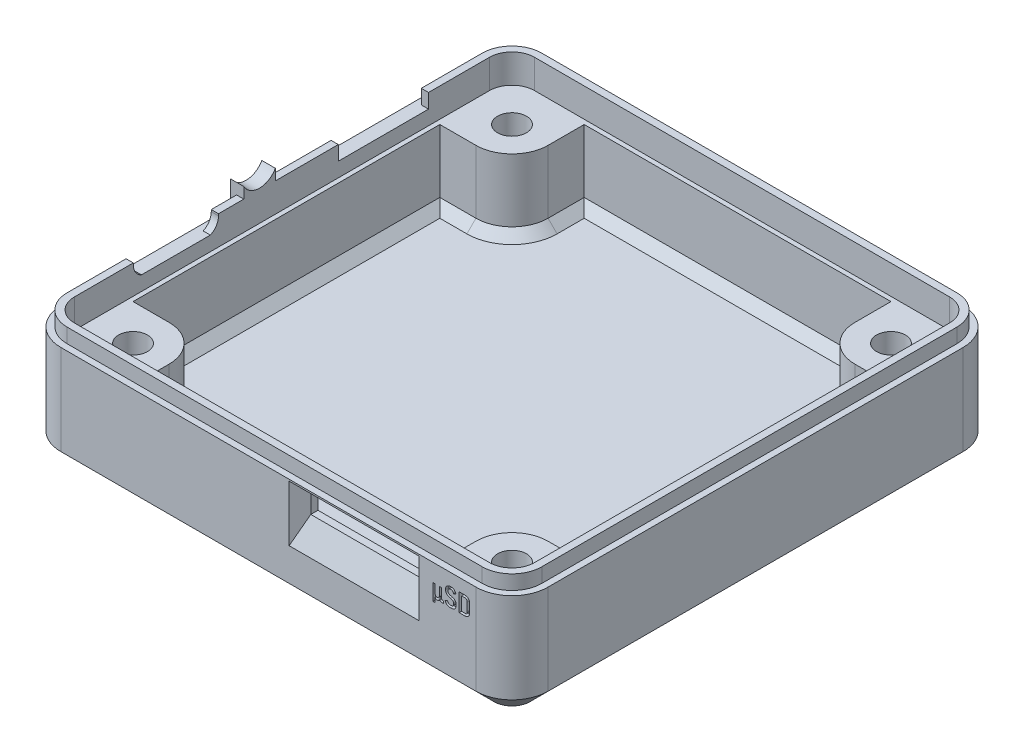
from build123d import *

# Parameters (mm, degrees)
BOSS_EXTRUDE1_DEPTH = 12
CUT_EXTRUDE1_DEPTH  = 1.6
CUT_EXTRUDE2_DEPTH  = 8
CUT_EXTRUDE3_REACH  = 41.575
SKETCH4_R           = 1.6
CHAMFER1_SIZE       = 2
CHAMFER2_SIZE       = 1
CUT_EXTRUDE4_REACH  = 63.555
SKETCH5_W           = 12
SKETCH5_H           = 2
CHAMFER3_SIZE       = 3
CHAMFER3_SIZE2      = 1.2
CHAMFER4_SIZE       = 1.2
BOSS_EXTRUDE2_START = 1.6
BOSS_EXTRUDE2_DEPTH = 1.6
SKETCH7_R           = 3
CUT_EXTRUDE5_DEPTH  = 4
CUT_EXTRUDE6_DEPTH  = 2
BOSS_EXTRUDE3_DEPTH = 1.5
CUT_EXTRUDE7_START  = 26.6
CUT_EXTRUDE7_DEPTH  = 0.4


# Read off the part's stored shape, not the designer's step: Cut-Extrude7
with BuildPart() as part:
    # Sketch1 → Boss-Extrude1 (new body)
    with BuildSketch(Plane(origin=(0, 0, 0), x_dir=(1, 0, 0), z_dir=(0, 1, 0))):
        with BuildLine():
            Line((-23, 27), (23, 27))
            ThreePointArc((23, 27), (25.828427125, 25.828427125), (27, 23))
            Line((27, 23), (27, -23))
            ThreePointArc((27, -23), (25.828427125, -25.828427125), (23, -27))
            Line((23, -27), (-23, -27))
            ThreePointArc((-23, -27), (-25.828427125, -25.828427125), (-27, -23))
            Line((-27, -23), (-27, 23))
            ThreePointArc((-27, 23), (-25.828427125, 25.828427125), (-23, 27))
        make_face()
    extrude(amount=BOSS_EXTRUDE1_DEPTH)

    # Sketch2 → Cut-Extrude1 (cut)
    with BuildSketch(Plane(origin=(0, 12, 0), x_dir=(1, 0, 0), z_dir=(0, 1, 0))):
        with BuildLine():
            Line((25.5, 23), (25.5, -23))
            ThreePointArc((25.5, -23), (24.767766953, -24.767766953), (23, -25.5))
            Line((23, -25.5), (-23, -25.5))
            ThreePointArc((-23, -25.5), (-24.767766953, -24.767766953), (-25.5, -23))
            Line((-25.5, -23), (-25.5, 23))
            ThreePointArc((-25.5, 23), (-24.767766953, 24.767766953), (-23, 25.5))
            Line((-23, 25.5), (23, 25.5))
            ThreePointArc((23, 25.5), (24.767766953, 24.767766953), (25.5, 23))
        make_face()
    extrude(amount=-CUT_EXTRUDE1_DEPTH, mode=Mode.SUBTRACT)

    # Sketch3 → Cut-Extrude2 (cut)
    with BuildSketch(Plane(origin=(0, 10.4, 0), x_dir=(1, 0, 0), z_dir=(0, 1, 0))):
        with BuildLine():
            Line((17, 21), (17, 25))
            Line((17, 25), (-17, 25))
            Line((-17, 25), (-17, 21))
            ThreePointArc((-17, 21), (-18.171572875, 18.171572875), (-21, 17))
            Line((-21, 17), (-25, 17))
            Line((-25, 17), (-25, -17))
            Line((-25, -17), (-21, -17))
            ThreePointArc((-21, -17), (-18.171572875, -18.171572875), (-17, -21))
            Line((-17, -21), (-17, -25))
            Line((-17, -25), (17, -25))
            Line((17, -25), (17, -21))
            ThreePointArc((17, -21), (18.171572875, -18.171572875), (21, -17))
            Line((21, -17), (25, -17))
            Line((25, -17), (25, 17))
            Line((25, 17), (21, 17))
            ThreePointArc((21, 17), (18.171572875, 18.171572875), (17, 21))
        make_face()
    extrude(amount=-CUT_EXTRUDE2_DEPTH, mode=Mode.SUBTRACT)

    # Sketch4 → Cut-Extrude3 (cut, up to next)
    with BuildSketch(Plane(origin=(0, 10.4, 0), x_dir=(1, 0, 0), z_dir=(0, 1, 0)), mode=Mode.PRIVATE) as cut_extrude3_sk1:
        with Locations(Location((-21, 21, 0), (0, 0, 270))):
            Circle(SKETCH4_R)
    cut_extrude3_tool1 = extrude(cut_extrude3_sk1.sketch, amount=-CUT_EXTRUDE3_REACH, mode=Mode.PRIVATE) & part.part
    # Sketch4 → Cut-Extrude3 (cut, up to next)
    with BuildSketch(Plane(origin=(0, 10.4, 0), x_dir=(1, 0, 0), z_dir=(0, 1, 0)), mode=Mode.PRIVATE) as cut_extrude3_sk2:
        with Locations(Location((21, 21, 0), (0, 0, 270))):
            Circle(SKETCH4_R)
    cut_extrude3_tool2 = extrude(cut_extrude3_sk2.sketch, amount=-CUT_EXTRUDE3_REACH, mode=Mode.PRIVATE) & part.part
    # Sketch4 → Cut-Extrude3 (cut, up to next)
    with BuildSketch(Plane(origin=(0, 10.4, 0), x_dir=(1, 0, 0), z_dir=(0, 1, 0)), mode=Mode.PRIVATE) as cut_extrude3_sk3:
        with Locations(Location((21, -21, 0), (0, 0, 270))):
            Circle(SKETCH4_R)
    cut_extrude3_tool3 = extrude(cut_extrude3_sk3.sketch, amount=-CUT_EXTRUDE3_REACH, mode=Mode.PRIVATE) & part.part
    # Sketch4 → Cut-Extrude3 (cut, up to next)
    with BuildSketch(Plane(origin=(0, 10.4, 0), x_dir=(1, 0, 0), z_dir=(0, 1, 0)), mode=Mode.PRIVATE) as cut_extrude3_sk4:
        with Locations(Location((-21, -21, 0), (0, 0, 270))):
            Circle(SKETCH4_R)
    cut_extrude3_tool4 = extrude(cut_extrude3_sk4.sketch, amount=-CUT_EXTRUDE3_REACH, mode=Mode.PRIVATE) & part.part
    add(cut_extrude3_tool1.solids().sort_by_distance((-21, 10.4, -21))[0], mode=Mode.SUBTRACT)
    add(cut_extrude3_tool2.solids().sort_by_distance((21, 10.4, -21))[0], mode=Mode.SUBTRACT)
    add(cut_extrude3_tool3.solids().sort_by_distance((21, 10.4, 21))[0], mode=Mode.SUBTRACT)
    add(cut_extrude3_tool4.solids().sort_by_distance((-21, 10.4, 21))[0], mode=Mode.SUBTRACT)

    # Chamfer1
    chamfer1_edges = [part.edges().sort_by_distance(p)[0] for p in [
        (-21, 0, 19.4),
        (0, 0, 27),
        (21, 0, 19.4),
        (21, 0, -22.6),
        (-25.828427125, 0, 25.828427125),
        (-21, 0, -22.6),
        (-27, 0, 0),
        (-25.828427125, 0, -25.828427125),
        (0, 0, -27),
        (25.828427125, 0, -25.828427125),
        (27, 0, 0),
        (25.828427125, 0, 25.828427125),
    ]]
    chamfer(chamfer1_edges, length=CHAMFER1_SIZE)

    # Chamfer2
    chamfer2_edges = [part.edges().sort_by_distance(p)[0] for p in [
        (-17, 2.4, -23),
        (18.171572875, 2.4, -18.171572875),
        (23, 2.4, -17),
        (18.171572875, 2.4, 18.171572875),
        (17, 2.4, 23),
        (0, 2.4, 25),
        (-18.171572875, 2.4, 18.171572875),
        (-23, 2.4, 17),
        (-25, 2.4, 0),
        (-18.171572875, 2.4, -18.171572875),
        (0, 2.4, -25),
        (17, 2.4, -23),
        (25, 2.4, 0),
        (23, 2.4, 17),
        (-17, 2.4, 23),
        (-23, 2.4, -17),
    ]]
    chamfer(chamfer2_edges, length=CHAMFER2_SIZE)

    # Sketch5 → Cut-Extrude4 (cut, up to next)
    with BuildSketch(Plane.XY.offset(27), mode=Mode.PRIVATE) as cut_extrude4_sk1:
        with Locations((9.5, 9.62)):
            Rectangle(SKETCH5_W, SKETCH5_H)
    cut_extrude4_tool1 = extrude(cut_extrude4_sk1.sketch, amount=-CUT_EXTRUDE4_REACH, mode=Mode.PRIVATE) & part.part
    add(cut_extrude4_tool1.solids().sort_by_distance((9.5, 9.62, 27))[0], mode=Mode.SUBTRACT)

    # Chamfer3
    chamfer3_edges = [part.edges().sort_by_distance(p)[0] for p in [
        (9.5, 8.62, 27),
    ]]
    chamfer3_side = [part.faces().sort_by_distance(p)[0] for p in [
        (-0.52293578, 6.855779817, 27),
    ]]
    chamfer(chamfer3_edges, length=CHAMFER3_SIZE, length2=CHAMFER3_SIZE2, reference=chamfer3_side[0])

    # Chamfer4
    chamfer4_edges = [part.edges().sort_by_distance(p)[0] for p in [
        (3.5, 8.12, 27),
        (9.5, 10.62, 27),
        (15.5, 8.12, 27),
    ]]
    chamfer(chamfer4_edges, length=CHAMFER4_SIZE)

    # Sketch6 → Boss-Extrude2 (add)
    with BuildSketch(Plane(origin=(0, 12, 0), x_dir=(1, 0, 0), z_dir=(0, 1, 0)).offset(BOSS_EXTRUDE2_START)):
        with BuildLine():
            Line((26.3, -23), (26.3, 23))
            ThreePointArc((26.3, 23), (25.333452378, 25.333452378), (23, 26.3))
            Line((23, 26.3), (-23, 26.3))
            ThreePointArc((-23, 26.3), (-25.333452378, 25.333452378), (-26.3, 23))
            Line((-26.3, 23), (-26.3, -23))
            ThreePointArc((-26.3, -23), (-25.333452378, -25.333452378), (-23, -26.3))
            Line((-23, -26.3), (23, -26.3))
            ThreePointArc((23, -26.3), (25.333452378, -25.333452378), (26.3, -23))
        make_face()
        with BuildLine():
            Line((25.5, -23), (25.5, 23))
            ThreePointArc((25.5, 23), (24.767766953, 24.767766953), (23, 25.5))
            Line((23, 25.5), (-23, 25.5))
            ThreePointArc((-23, 25.5), (-24.767766953, 24.767766953), (-25.5, 23))
            Line((-25.5, 23), (-25.5, -23))
            ThreePointArc((-25.5, -23), (-24.767766953, -24.767766953), (-23, -25.5))
            Line((-23, -25.5), (23, -25.5))
            ThreePointArc((23, -25.5), (24.767766953, -24.767766953), (25.5, -23))
        make_face(mode=Mode.SUBTRACT)
    extrude(amount=-BOSS_EXTRUDE2_DEPTH)

    # Sketch7 → Cut-Extrude5 (cut)
    with BuildSketch(Plane.XZ):
        with Locations(Location((-21, 21, 0), (0, 0, 270))):
            Circle(SKETCH7_R)
        with Locations(Location((21, 21, 0), (0, 0, 270))):
            Circle(SKETCH7_R)
        with Locations(Location((21, -21, 0), (0, 0, 270))):
            Circle(SKETCH7_R)
        with Locations(Location((-21, -21, 0), (0, 0, 270))):
            Circle(SKETCH7_R)
    extrude(amount=-CUT_EXTRUDE5_DEPTH, mode=Mode.SUBTRACT)

    # Sketch8 → Cut-Extrude6 (cut)
    with BuildSketch(Plane(origin=(-27, 10.4, -7.316869261), x_dir=(0, 0, 1), z_dir=(-1, 0, 0))):
        with BuildLine():
            ThreePointArc((14.346869261, 2.9962), (14.59268632, 2.164470372), (15.251149227, 1.6))
            Line((15.251149227, 1.6), (22.882589294, 1.6))
            ThreePointArc((22.882589294, 1.6), (23.541052201, 2.164470372), (23.786869261, 2.9962))
            Line((23.786869261, 2.9962), (23.786869261, 3.5962))
            ThreePointArc((23.786869261, 3.5962), (23.338742636, 4.678073375), (22.256869261, 5.1262))
            Line((22.256869261, 5.1262), (15.876869261, 5.1262))
            ThreePointArc((15.876869261, 5.1262), (14.794995885, 4.678073375), (14.346869261, 3.5962))
            Line((14.346869261, 3.5962), (14.346869261, 2.9962))
        make_face()
        with BuildLine():
            ThreePointArc((11.541738116, 5.3762), (9.793138116, 7.1248), (8.044538116, 5.3762))
            Line((8.044538116, 5.3762), (8.044538116, 1.6))
            Line((8.044538116, 1.6), (11.541738116, 1.6))
            Line((11.541738116, 1.6), (11.541738116, 5.3762))
        make_face()
        with BuildLine():
            Line((-8.933130739, 1.6), (1.066869261, 1.6))
            Line((1.066869261, 1.6), (1.066869261, 5.0662))
            Line((1.066869261, 5.0662), (-0.183130739, 5.0662))
            ThreePointArc((-0.183130739, 5.0662), (-0.549247263, 5.950083476), (-1.433130739, 6.3162))
            Line((-1.433130739, 6.3162), (-1.784381522, 6.3162))
            ThreePointArc((-1.784381522, 6.3162), (-1.893066847, 6.362819634), (-1.934193904, 6.4737))
            ThreePointArc((-1.934193904, 6.4737), (-1.933396572, 6.494943352), (-1.933130739, 6.5162))
            ThreePointArc((-1.933130739, 6.5162), (-2.089108646, 7.006947729), (-2.499797406, 7.317587685))
            ThreePointArc((-2.499797406, 7.317587685), (-2.639394057, 7.353958776), (-2.783130739, 7.3662))
            Line((-2.783130739, 7.3662), (-2.783130739, 7.7662))
            ThreePointArc((-2.783130739, 7.7662), (-2.856354044, 7.942976695), (-3.033130739, 8.0162))
            Line((-3.033130739, 8.0162), (-4.833130739, 8.0162))
            ThreePointArc((-4.833130739, 8.0162), (-5.009907435, 7.942976695), (-5.083130739, 7.7662))
            Line((-5.083130739, 7.7662), (-5.083130739, 7.3662))
            ThreePointArc((-5.083130739, 7.3662), (-5.226867421, 7.353958776), (-5.366464073, 7.317587685))
            ThreePointArc((-5.366464073, 7.317587685), (-5.777152833, 7.006947729), (-5.933130739, 6.5162))
            ThreePointArc((-5.933130739, 6.5162), (-5.932864907, 6.494943352), (-5.932067574, 6.4737))
            ThreePointArc((-5.932067574, 6.4737), (-5.973194632, 6.362819634), (-6.081879957, 6.3162))
            Line((-6.081879957, 6.3162), (-6.433130739, 6.3162))
            ThreePointArc((-6.433130739, 6.3162), (-7.317014216, 5.950083476), (-7.683130739, 5.0662))
            Line((-7.683130739, 5.0662), (-8.933130739, 5.0662))
            Line((-8.933130739, 5.0662), (-8.933130739, 1.6))
        make_face()
    extrude(amount=-CUT_EXTRUDE6_DEPTH, mode=Mode.SUBTRACT)

    # Sketch9 → Boss-Extrude3 (add)
    with BuildSketch(Plane.ZY.offset(27)):
        with BuildLine():
            Line((0.727668855, 12), (4.224868855, 12))
            Line((4.224868855, 12), (4.224868855, 14.812115709))
            ThreePointArc((4.224868855, 14.812115709), (2.476268855, 13.7814), (0.727668855, 14.812115709))
            Line((0.727668855, 14.812115709), (0.727668855, 12))
        make_face()
    extrude(amount=-BOSS_EXTRUDE3_DEPTH)

    # Cut-Extrude7 outline → Cut-Extrude7 (cut)
    # profile 1 of 3: a face of its own
    with BuildSketch(Plane.XY.offset(CUT_EXTRUDE7_START)):
        with BuildLine():
            add(Edge.make_bspline(
                [(21.724852959, 10.62), (21.754921646, 10.619271309), (21.813015891, 10.617863441), (21.896876302, 10.605545038), (21.973886193, 10.585003144), (22.043809679, 10.55593927), (22.10646802, 10.519171143), (22.161355545, 10.474236142), (22.208411299, 10.421519954), (22.246794779, 10.360932986), (22.277078021, 10.29354723), (22.298714945, 10.219381504), (22.311222595, 10.138526993), (22.312926797, 10.082445051), (22.313807513, 10.053462401)],
                knots=[0, 0, 0, 0, 0.096977393, 0.187365291, 0.272756147, 0.353516165, 0.430951507, 0.506332135, 0.581470196, 0.657957979, 0.736829253, 0.819083992, 0.90650421, 1, 1, 1, 1], degree=3))
            Line((21.724852959, 10.62), (21.146087929, 10.62))
            Line((21.146087929, 10.62), (21.146087929, 8.62))
            Line((21.146087929, 8.62), (21.723630216, 8.62))
            add(Edge.make_bspline(
                [(22.313807513, 9.188167923), (22.312977254, 9.159177205), (22.311370073, 9.103058191), (22.298172357, 9.022291889), (22.276680054, 8.947900912), (22.246094954, 8.880319647), (22.207120463, 8.819967519), (22.160450693, 8.766686793), (22.105268832, 8.721821849), (22.042723513, 8.68438617), (21.972647161, 8.655405288), (21.895620174, 8.634981778), (21.811833555, 8.621992751), (21.753705828, 8.620679489), (21.723630216, 8.62)],
                knots=[0, 0, 0, 0, 0.093355606, 0.18071386, 0.262845271, 0.342177585, 0.418787378, 0.493522382, 0.569406, 0.646949161, 0.72758809, 0.812850914, 0.90316801, 1, 1, 1, 1], degree=3))
            Line((22.313807513, 9.188167923), (22.313807513, 10.053462401))
        make_face()
        with BuildLine():
            add(Edge.make_bspline(
                [(21.73341216, 8.877183615), (21.745242502, 8.877404307), (21.768283578, 8.877834131), (21.801678352, 8.88155883), (21.833125596, 8.887538977), (21.862356958, 8.89665967), (21.889867084, 8.907594201), (21.915426322, 8.92088726), (21.938196935, 8.937673608), (21.9596905, 8.955745355), (21.97831384, 8.976882503), (21.995281119, 8.999543668), (22.008932459, 9.024671879), (22.020768025, 9.051396847), (22.028842476, 9.080451157), (22.035742418, 9.111263482), (22.039192027, 9.144206626), (22.039669331, 9.166831909), (22.039913077, 9.178385979)],
                knots=[0, 0, 0, 0, 0.072644297, 0.14148389, 0.206129053, 0.268955015, 0.329235434, 0.387846522, 0.445275366, 0.502661753, 0.559975284, 0.617893149, 0.676170608, 0.735231464, 0.797017985, 0.861013541, 0.92902368, 1, 1, 1, 1], degree=3))
            Line((21.73341216, 8.877183615), (21.416721718, 8.877183615))
            Line((21.416721718, 8.877183615), (21.416721718, 10.362816385))
            Line((21.416721718, 10.362816385), (21.73341216, 10.362816385))
            add(Edge.make_bspline(
                [(22.039913077, 10.061614021), (22.039676764, 10.073304768), (22.039216644, 10.096067593), (22.035692425, 10.129269336), (22.028902653, 10.160240051), (22.020767239, 10.189421056), (22.008913824, 10.216129052), (21.995407268, 10.2412285), (21.978179581, 10.263566195), (21.9596854, 10.284641075), (21.938339253, 10.302809033), (21.915176221, 10.318983446), (21.889999522, 10.332899928), (21.862409226, 10.34382459), (21.833051854, 10.352339106), (21.801688625, 10.358478562), (21.768280773, 10.362155658), (21.74524155, 10.362592229), (21.73341216, 10.362816385)],
                knots=[0, 0, 0, 0, 0.071763221, 0.139728769, 0.204498196, 0.266244207, 0.325266341, 0.383505591, 0.440714722, 0.497990675, 0.555339437, 0.612249951, 0.671219037, 0.731459933, 0.794006094, 0.858608873, 0.927403332, 1, 1, 1, 1], degree=3))
            Line((22.039913077, 10.061614021), (22.039913077, 9.178385979))
        make_face(mode=Mode.SUBTRACT)
    # profile 2 of 3: a face of its own
    with BuildSketch(Plane.XY.offset(CUT_EXTRUDE7_START)):
        with BuildLine():
            add(Edge.make_bspline(
                [(20.803719884, 9.124992867), (20.802875064, 9.098175922), (20.801239012, 9.046243019), (20.78815549, 8.971147181), (20.765729723, 8.902260115), (20.73456451, 8.839500595), (20.694661396, 8.783514688), (20.646337358, 8.734477907), (20.589867638, 8.692513611), (20.525167456, 8.658354948), (20.453151657, 8.631334769), (20.37374347, 8.61326253), (20.287705611, 8.600823473), (20.227856577, 8.599763067), (20.196831765, 8.599213369)],
                knots=[0, 0, 0, 0, 0.08815625, 0.170720785, 0.249702938, 0.325632256, 0.400268868, 0.47483189, 0.551145404, 0.630701742, 0.714685444, 0.80333285, 0.898050796, 1, 1, 1, 1], degree=3))
            Line((20.803719884, 9.124992867), (20.803719884, 9.217106175))
            add(Edge.make_bspline(
                [(20.320736391, 9.742478093), (20.345116836, 9.735062315), (20.391987174, 9.720805807), (20.458229698, 9.697300265), (20.517579679, 9.67305912), (20.571368519, 9.64887232), (20.619948771, 9.620442638), (20.663644799, 9.58534634), (20.702912312, 9.543107317), (20.738654565, 9.494650228), (20.768912022, 9.437992705), (20.788933686, 9.371860303), (20.801855518, 9.297361818), (20.803077777, 9.244747053), (20.803719884, 9.217106175)],
                knots=[0, 0, 0, 0, 0.097315748, 0.187085257, 0.268310298, 0.342129562, 0.412160857, 0.482659594, 0.555337638, 0.631823927, 0.712127281, 0.799260945, 0.894542841, 1, 1, 1, 1], degree=3))
            add(Edge.make_bspline(
                [(20.295873949, 9.74940697), (20.297924965, 9.748907661), (20.302064943, 9.747899805), (20.30813926, 9.745538157), (20.31451401, 9.744208313), (20.318704507, 9.743043087), (20.320736391, 9.742478093)],
                knots=[0, 0, 0, 0, 0.245045704, 0.494625012, 0.754954296, 1, 1, 1, 1], degree=3))
            add(Edge.make_bspline(
                [(20.273864575, 9.756335847), (20.275786031, 9.755850528), (20.279545562, 9.754900952), (20.284889672, 9.752457348), (20.290473412, 9.751146138), (20.294115097, 9.749973384), (20.295873949, 9.74940697)],
                knots=[0, 0, 0, 0, 0.257019296, 0.502885402, 0.759904698, 1, 1, 1, 1], degree=3))
            add(Edge.make_bspline(
                [(19.907856831, 10.056315468), (19.908267244, 10.041847245), (19.90905904, 10.013934193), (19.918962904, 9.974534521), (19.933391873, 9.938772472), (19.955148272, 9.908180721), (19.981161631, 9.881814302), (20.009838113, 9.858377893), (20.04143954, 9.838255899), (20.076812197, 9.821385191), (20.116978326, 9.805703462), (20.163336295, 9.790350924), (20.216087329, 9.772728476), (20.253843164, 9.762016345), (20.273864575, 9.756335847)],
                knots=[0, 0, 0, 0, 0.083870077, 0.161807705, 0.23468656, 0.306739663, 0.378206448, 0.44947672, 0.521534149, 0.595330931, 0.67684543, 0.771970436, 0.879078994, 1, 1, 1, 1], degree=3))
            Line((19.907856831, 10.056315468), (19.907856831, 10.119490524))
            add(Edge.make_bspline(
                [(20.23555196, 10.381972692), (20.222774005, 10.381721635), (20.197990493, 10.381234696), (20.162043111, 10.37795566), (20.128409947, 10.372660263), (20.096847348, 10.36546787), (20.067530396, 10.355694095), (20.040424013, 10.343755076), (20.015315221, 10.330075545), (19.993034216, 10.313568499), (19.972724605, 10.295752906), (19.955625647, 10.275504849), (19.94083953, 10.253799008), (19.928505008, 10.23048678), (19.918988621, 10.205305274), (19.912724373, 10.178287456), (19.908372539, 10.149520168), (19.908032119, 10.129697551), (19.907856831, 10.119490524)],
                knots=[0, 0, 0, 0, 0.080514319, 0.156161738, 0.227238616, 0.29493546, 0.359908838, 0.421625236, 0.481411386, 0.539632441, 0.596011643, 0.65126157, 0.706112095, 0.761255798, 0.817066652, 0.875205826, 0.935741197, 1, 1, 1, 1], degree=3))
            add(Edge.make_bspline(
                [(20.525749637, 10.120713267), (20.51941824, 10.140715257), (20.507214883, 10.179267796), (20.482150061, 10.232289929), (20.451031494, 10.277427417), (20.415691613, 10.31533111), (20.375697991, 10.345026942), (20.332205907, 10.366743885), (20.284941975, 10.379834631), (20.252208953, 10.381251622), (20.23555196, 10.381972692)],
                knots=[0, 0, 0, 0, 0.1491196, 0.287418366, 0.41526632, 0.537617375, 0.654344721, 0.76756384, 0.881719214, 1, 1, 1, 1], degree=3))
            Line((20.525749637, 10.120713267), (20.777227118, 10.236466273))
            add(Edge.make_bspline(
                [(20.23555196, 10.640786631), (20.25827269, 10.640302418), (20.302678021, 10.639356072), (20.367249475, 10.630125184), (20.428044704, 10.615527585), (20.484978054, 10.595176685), (20.53793916, 10.568952002), (20.586601352, 10.537164982), (20.630758872, 10.499564709), (20.670180628, 10.45656123), (20.705632095, 10.408922384), (20.734691161, 10.355725264), (20.759809948, 10.298317007), (20.771326268, 10.257420994), (20.777227118, 10.236466273)],
                knots=[0, 0, 0, 0, 0.092770778, 0.181310952, 0.265850036, 0.347838145, 0.427763856, 0.506735728, 0.584696671, 0.664036313, 0.744629875, 0.826625498, 0.911164581, 1, 1, 1, 1], degree=3))
            add(Edge.make_bspline(
                [(19.638445785, 10.116637457), (19.63926338, 10.143461004), (19.64084263, 10.195272809), (19.654207071, 10.269938932), (19.675636396, 10.33862552), (19.705993409, 10.40122545), (19.744878988, 10.457398955), (19.792938809, 10.50565268), (19.848325631, 10.547591294), (19.911984608, 10.581583003), (19.982933307, 10.608528245), (20.061101296, 10.627465873), (20.146084785, 10.638944837), (20.205081479, 10.640159358), (20.23555196, 10.640786631)],
                knots=[0, 0, 0, 0, 0.089045978, 0.171999355, 0.25107216, 0.327368415, 0.402237791, 0.476915129, 0.552644665, 0.632209213, 0.715774168, 0.804107073, 0.898825658, 1, 1, 1, 1], degree=3))
            Line((19.638445785, 10.116637457), (19.638445785, 10.057538211))
            add(Edge.make_bspline(
                [(20.15851915, 9.518308539), (20.132252551, 9.526037027), (20.082080371, 9.540799315), (20.010884504, 9.564333079), (19.947475499, 9.588469559), (19.89005093, 9.612187399), (19.838483756, 9.640667635), (19.7918845, 9.676425954), (19.749105661, 9.719059096), (19.716746788, 9.75977499), (19.694069212, 9.796365508), (19.678933177, 9.826595998), (19.666381928, 9.859251498), (19.656185309, 9.894316454), (19.648080319, 9.931620613), (19.642373191, 9.971525112), (19.639229947, 10.01373998), (19.638711011, 10.04272442), (19.638445785, 10.057538211)],
                knots=[0, 0, 0, 0, 0.099366941, 0.189802115, 0.272038598, 0.345587195, 0.415125929, 0.485143735, 0.55801321, 0.633866045, 0.673274721, 0.714068704, 0.756372349, 0.800058543, 0.846480587, 0.894804053, 0.946234918, 1, 1, 1, 1], degree=3))
            Line((20.15851915, 9.518308539), (20.173599647, 9.514232729))
            add(Edge.make_bspline(
                [(20.185827077, 9.510156919), (20.184630622, 9.510659379), (20.182667025, 9.511484006), (20.179553466, 9.511566946), (20.17699814, 9.513364427), (20.174855044, 9.51391198), (20.173599647, 9.514232729)],
                knots=[0, 0, 0, 0, 0.298660247, 0.490155066, 0.701339753, 1, 1, 1, 1], degree=3))
            add(Edge.make_bspline(
                [(20.533901257, 9.214253108), (20.53338592, 9.228426345), (20.532389567, 9.255828898), (20.523878211, 9.294769533), (20.509376909, 9.329612859), (20.489007365, 9.35979435), (20.464691177, 9.386541261), (20.436805788, 9.409708185), (20.405874522, 9.42991009), (20.371382952, 9.447081649), (20.332449893, 9.462588927), (20.288607992, 9.478279171), (20.239227583, 9.494751464), (20.204208676, 9.504854031), (20.185827077, 9.510156919)],
                knots=[0, 0, 0, 0, 0.085228263, 0.164780432, 0.238432725, 0.311001401, 0.382778066, 0.455328314, 0.528580122, 0.604639387, 0.686783967, 0.780671697, 0.884873482, 1, 1, 1, 1], degree=3))
            Line((20.533901257, 9.214253108), (20.533901257, 9.124992867))
            add(Edge.make_bspline(
                [(20.196831765, 8.858027308), (20.210018238, 8.858273776), (20.235617305, 8.858752246), (20.272768224, 8.862102059), (20.307575708, 8.867144895), (20.339938991, 8.875093614), (20.370225059, 8.884617614), (20.39800359, 8.896964184), (20.423447401, 8.911217678), (20.446433781, 8.927590893), (20.466963273, 8.946035058), (20.484910362, 8.966395842), (20.500157461, 8.988546204), (20.512353195, 9.012468194), (20.522365541, 9.03792656), (20.529134262, 9.06533145), (20.53335578, 9.094563276), (20.533715891, 9.114652152), (20.533901257, 9.124992867)],
                knots=[0, 0, 0, 0, 0.08115814, 0.157553313, 0.229463839, 0.297414002, 0.362472226, 0.424627728, 0.484168422, 0.541720179, 0.597975297, 0.65367444, 0.708417385, 0.763026022, 0.818624625, 0.876431011, 0.936393071, 1, 1, 1, 1], degree=3))
            add(Edge.make_bspline(
                [(19.850387909, 9.133144487), (19.857144402, 9.112133753), (19.870177324, 9.071605143), (19.898684379, 9.016032748), (19.933959617, 8.968268981), (19.975577909, 8.928121524), (20.023200488, 8.896217501), (20.076778245, 8.874359835), (20.135113273, 8.860315972), (20.175824335, 8.858806312), (20.196831765, 8.858027308)],
                knots=[0, 0, 0, 0, 0.138004104, 0.266202709, 0.389026266, 0.508135823, 0.626560092, 0.745508581, 0.868679173, 1, 1, 1, 1], degree=3))
            Line((19.850387909, 9.133144487), (19.590351227, 9.021874873))
            add(Edge.make_bspline(
                [(20.196831765, 8.599213369), (20.170994439, 8.599882589), (20.120654185, 8.601186468), (20.047178159, 8.610080043), (19.978288268, 8.625587117), (19.91373066, 8.646746234), (19.854103753, 8.673866283), (19.799902719, 8.70734707), (19.750359543, 8.745706863), (19.706714113, 8.79042809), (19.66850061, 8.840518675), (19.636256, 8.896019673), (19.609390836, 8.956686498), (19.596789768, 8.999830407), (19.590351227, 9.021874873)],
                knots=[0, 0, 0, 0, 0.096524429, 0.188063745, 0.275985395, 0.359931682, 0.441467972, 0.520076357, 0.597447621, 0.674975229, 0.752839399, 0.832232085, 0.914278651, 1, 1, 1, 1], degree=3))
        make_face()
    # profile 3 of 3: a face of its own
    with BuildSketch(Plane.XY.offset(CUT_EXTRUDE7_START)):
        with BuildLine():
            add(Edge.make_bspline(
                [(19.210485728, 8.994159364), (19.210787411, 8.985035366), (19.211354435, 8.967886476), (19.21583358, 8.943663281), (19.223351991, 8.922633209), (19.234528964, 8.905082881), (19.24868156, 8.89134616), (19.265344325, 8.881240267), (19.284708453, 8.875473891), (19.298349166, 8.874722046), (19.305452103, 8.874330548)],
                knots=[0, 0, 0, 0, 0.157979971, 0.296929162, 0.42502858, 0.542549659, 0.654072238, 0.763867621, 0.877042111, 1, 1, 1, 1], degree=3))
            Line((19.210485728, 8.994159364), (19.210485728, 10.047756267))
            Line((19.210485728, 10.047756267), (18.93985194, 10.047756267))
            Line((18.93985194, 10.047756267), (18.93985194, 9.082196862))
            add(Edge.make_bspline(
                [(18.712829319, 8.860880375), (18.73028107, 8.861527239), (18.763370555, 8.862753729), (18.809814527, 8.873406736), (18.849877151, 8.890827621), (18.883146064, 8.915869208), (18.908880359, 8.948210398), (18.927616345, 8.987109555), (18.937868625, 9.032770585), (18.939168489, 9.065164553), (18.93985194, 9.082196862)],
                knots=[0, 0, 0, 0, 0.144465125, 0.27391388, 0.392342825, 0.504029604, 0.615329844, 0.731647529, 0.85890392, 1, 1, 1, 1], degree=3))
            add(Edge.make_bspline(
                [(18.488659765, 9.079343795), (18.489294228, 9.062432305), (18.490490622, 9.030542598), (18.501241436, 8.985652878), (18.519061101, 8.94707637), (18.54455807, 8.915029353), (18.577519991, 8.890496921), (18.6168632, 8.872933976), (18.662883847, 8.862859231), (18.69552324, 8.861566047), (18.712829319, 8.860880375)],
                knots=[0, 0, 0, 0, 0.141766485, 0.267326639, 0.38464241, 0.495765468, 0.607285646, 0.726192156, 0.854821443, 1, 1, 1, 1], degree=3))
            Line((18.488659765, 9.079343795), (18.488659765, 10.054685144))
            Line((18.488659765, 10.054685144), (18.217618396, 10.054685144))
            Line((18.217618396, 10.054685144), (18.217618396, 8.234835949))
            Line((18.217618396, 8.234835949), (18.488659765, 8.234835949))
            Line((18.488659765, 8.234835949), (18.476805262, 8.756085427))
            add(Edge.make_bspline(
                [(18.712829319, 8.599213369), (18.699637184, 8.599657652), (18.674228702, 8.600513357), (18.637734406, 8.605529077), (18.604740247, 8.615039606), (18.575096574, 8.627967357), (18.548963079, 8.644949376), (18.526399105, 8.665573702), (18.506901158, 8.689545809), (18.49100732, 8.717245026), (18.48166099, 8.740003922), (18.477586215, 8.753369898), (18.476805262, 8.756085427)],
                knots=[0, 0, 0, 0, 0.095480351, 0.183898279, 0.265726169, 0.343179826, 0.417070613, 0.490139453, 0.56352501, 0.639733492, 0.720419707, 0.740869787, 0.740869787, 0.740869787, 0.740869787], degree=3))
            add(Edge.make_bspline(
                [(18.983035474, 8.781841919), (18.979545421, 8.771029264), (18.969206911, 8.744033805), (18.947021051, 8.703955119), (18.913611865, 8.665204856), (18.872611581, 8.635361403), (18.825213401, 8.613958241), (18.771101559, 8.601136284), (18.732874439, 8.599874834), (18.712829319, 8.599213369)],
                knots=[0.194460304, 0.194460304, 0.194460304, 0.194460304, 0.272396537, 0.392309988, 0.507395199, 0.620872666, 0.737796954, 0.862508826, 1, 1, 1, 1], degree=3))
            add(Edge.make_bspline(
                [(19.274068365, 8.617146933), (19.261149256, 8.617483086), (19.23591083, 8.618139785), (19.199178398, 8.622574624), (19.16470901, 8.630217048), (19.132698363, 8.641425893), (19.102634045, 8.655223387), (19.074930963, 8.672432235), (19.049332283, 8.692500511), (19.026480696, 8.715919438), (19.006166507, 8.742139587), (18.991933368, 8.764457838), (18.984862086, 8.778120225), (18.983035474, 8.781841919)],
                knots=[0, 0, 0, 0, 0.067564804, 0.131992799, 0.193189277, 0.251841096, 0.309063655, 0.365856646, 0.422010364, 0.478790017, 0.536500222, 0.595250958, 0.61692464, 0.61692464, 0.61692464, 0.61692464], degree=3))
            Line((19.274068365, 8.617146933), (19.411423165, 8.617146933))
            Line((19.411423165, 8.617146933), (19.411423165, 8.874330548))
            Line((19.411423165, 8.874330548), (19.305452103, 8.874330548))
        make_face()
    extrude(amount=CUT_EXTRUDE7_DEPTH, mode=Mode.SUBTRACT)


solid = part.part
